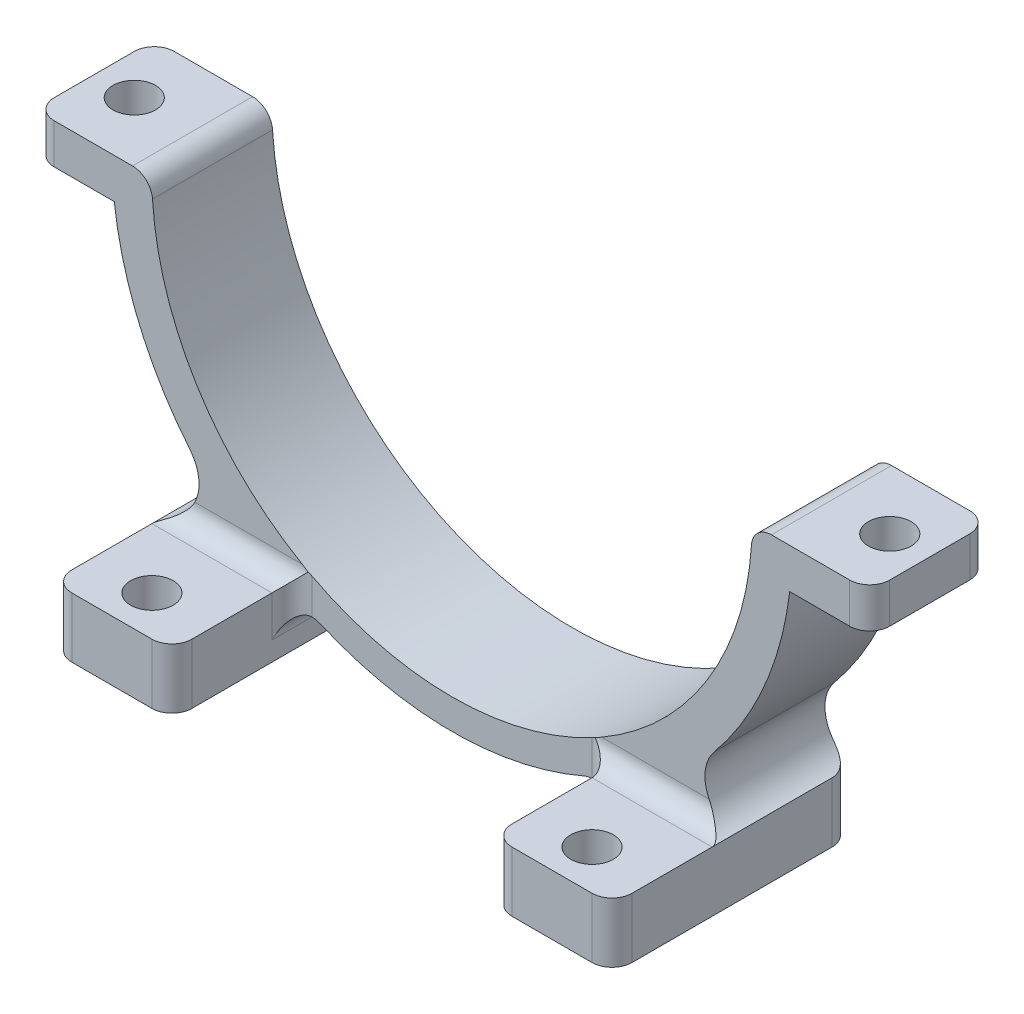
from build123d import *

# Parameters (mm, degrees)
BOSS_EXTRUDE2_DEPTH = 9.525
CUT_EXTRUDE2_REACH  = 84.186
SKETCH5_R           = 3.3782
BOSS_EXTRUDE3_DEPTH = 19.05
CUT_EXTRUDE3_REACH  = 86.782
SKETCH7_R           = 3.3782
CUT_EXTRUDE5_REACH  = 89.589
FILLET3_R           = 6.35
FILLET4_R           = 3.175


with BuildPart() as part:
    # Sketch1 → Boss-Extrude2 (new, symmetric)
    with BuildSketch(Plane.XY):
        with BuildLine():
            Line((-47.62499999999999, 0), (-66.30016907622587, -2.27e-15))
            Line((-66.30016907622587, -2.27e-15), (-66.30016907622587, -6.350000000000002))
            Line((-66.30016907622587, -6.350000000000002), (-53.60016907622586, -6.350000000000002))
            ThreePointArc((-53.60016907622586, -6.350000000000002), (-46.217987777388224, -27.87827524810658), (-30.618591166152626, -44.449999999999996))
            Line((-30.618591166152626, -44.449999999999996), (-44.449999999999996, -44.449999999999996))
            Line((-44.449999999999996, -44.449999999999996), (-44.449999999999996, -53.975))
            Line((-44.449999999999996, -53.975), (44.449999999999996, -53.975))
            Line((44.449999999999996, -53.975), (44.449999999999996, -44.449999999999996))
            Line((44.449999999999996, -44.449999999999996), (30.618591166152626, -44.449999999999996))
            ThreePointArc((30.618591166152626, -44.449999999999996), (46.21798777738823, -27.878275248106572), (53.60016907622586, -6.350000000000002))
            Line((53.60016907622586, -6.350000000000002), (66.30016907622587, -6.350000000000002))
            Line((66.30016907622587, -6.350000000000002), (66.30016907622587, -2.27e-15))
            Line((66.30016907622587, -2.27e-15), (47.62499999999999, 0))
            ThreePointArc((47.62499999999999, 0), (-8.75e-15, -47.62499999999999), (-47.62499999999999, 0))
        make_face()
    extrude(amount=BOSS_EXTRUDE2_DEPTH, both=True)

    # Sketch5 → Cut-Extrude2 (cut, up to next)
    with BuildSketch(Plane.XZ.offset(6.350000000000002), mode=Mode.PRIVATE) as cut_extrude2_sk1:
        with Locations(Location((-59.95016907622586, 0, 0), (0, 0, 270))):
            Circle(SKETCH5_R)
    cut_extrude2_tool1 = extrude(cut_extrude2_sk1.sketch, amount=-CUT_EXTRUDE2_REACH, mode=Mode.PRIVATE) & part.part
    # Sketch5 → Cut-Extrude2 (cut, up to next)
    with BuildSketch(Plane.XZ.offset(6.350000000000002), mode=Mode.PRIVATE) as cut_extrude2_sk2:
        with Locations(Location((59.95016907622586, 0, 0), (0, 0, 270))):
            Circle(SKETCH5_R)
    cut_extrude2_tool2 = extrude(cut_extrude2_sk2.sketch, amount=-CUT_EXTRUDE2_REACH, mode=Mode.PRIVATE) & part.part
    add(cut_extrude2_tool1.solids().sort_by_distance((-59.950169, -6.35, 0))[0], mode=Mode.SUBTRACT)
    add(cut_extrude2_tool2.solids().sort_by_distance((59.950169, -6.35, 0))[0], mode=Mode.SUBTRACT)

    # Sketch6 → Boss-Extrude3 (add)
    with BuildSketch(Plane.XY.offset(9.525)):
        Polygon((-44.449999999999996, -44.449999999999996), (-25.39999999999999, -44.449999999999996), (-25.399999999999995, -53.975), (-44.449999999999996, -53.975), align=None)
        Polygon((44.449999999999996, -53.975), (25.399999999999995, -53.975), (25.39999999999999, -44.449999999999996), (44.449999999999996, -44.449999999999996), align=None)
    extrude(amount=BOSS_EXTRUDE3_DEPTH)

    # Sketch7 → Cut-Extrude3 (cut, up to next)
    with BuildSketch(Plane(origin=(0, -44.449999999999996, 0), x_dir=(1, 0, 0), z_dir=(0, 1, 0)), mode=Mode.PRIVATE) as cut_extrude3_sk1:
        with Locations(Location((-34.925, -22.225, 0), (0, 0, 270))):
            Circle(SKETCH7_R)
    cut_extrude3_tool1 = extrude(cut_extrude3_sk1.sketch, amount=-CUT_EXTRUDE3_REACH, mode=Mode.PRIVATE) & part.part
    # Sketch7 → Cut-Extrude3 (cut, up to next)
    with BuildSketch(Plane(origin=(0, -44.449999999999996, 0), x_dir=(1, 0, 0), z_dir=(0, 1, 0)), mode=Mode.PRIVATE) as cut_extrude3_sk2:
        with Locations(Location((34.925, -22.225, 0), (0, 0, 270))):
            Circle(SKETCH7_R)
    cut_extrude3_tool2 = extrude(cut_extrude3_sk2.sketch, amount=-CUT_EXTRUDE3_REACH, mode=Mode.PRIVATE) & part.part
    add(cut_extrude3_tool1.solids().sort_by_distance((-34.925, -44.45, 22.225))[0], mode=Mode.SUBTRACT)
    add(cut_extrude3_tool2.solids().sort_by_distance((34.925, -44.45, 22.225))[0], mode=Mode.SUBTRACT)

    # Sketch10 → Cut-Extrude5 (cut, up to next)
    with BuildSketch(Plane.XY.offset(9.525), mode=Mode.PRIVATE) as cut_extrude5_sk1:
        with BuildLine():
            Line((-25.4, -45.81801126467626), (-25.399999999999995, -53.975))
            Line((-25.399999999999995, -53.975), (25.399999999999995, -53.975))
            Line((25.399999999999995, -53.975), (25.39999999999999, -45.818011264676265))
            ThreePointArc((25.39999999999999, -45.818011264676265), (3.21e-15, -52.3875), (-25.4, -45.81801126467626))
        make_face()
    cut_extrude5_tool1 = extrude(cut_extrude5_sk1.sketch, amount=-CUT_EXTRUDE5_REACH, mode=Mode.PRIVATE) & part.part
    add(cut_extrude5_tool1.solids().sort_by_distance((-24.885493, -49.896506, 9.525))[0], mode=Mode.SUBTRACT)

    # Fillet3
    # the kernel refuses this fillet: 6.35 mm, written as the material it adds along each edge
    with BuildSketch(Plane(origin=(30.618591166152626, -44.449999999999996, -9.525), x_dir=(1, -5.1e-16, 0), z_dir=(0, 0, 1))) as fillet3_piece_1:
        with BuildLine():
            CenterArc((15.87487517374333, 6.012216339895979), FILLET3_R, 140.4182638704102, 110.80957357767647)
            Line((10.980826085333229, 10.058298830433243), (10.88294510356503, 10.13922048024399))
            ThreePointArc((10.88294510356503, 10.13922048024399), (5.753170572776132, 4.742292284663466), (-0.07204374392036078, 0.10458823529411627))
            Line((-0.07204374392036078, 0.10458823529411627), (7e-17, -0.12700000000000244))
            ThreePointArc((7e-17, -0.12700000000000244), (6.915704416923688, -0.1269999999999989), (13.790539507049452, -0.12024432679791633))
            Line((13.790539507049452, -0.12024432679791633), (13.83140883384737, 0))
        make_face()
    extrude(amount=19.05)
    with BuildSketch(Plane(origin=(-30.618591166152626, -44.45, -9.525), x_dir=(-0.7374035751622449, 0.6754524167829585, 0), z_dir=(0, 0, 1))) as fillet3_piece_2:
        with BuildLine():
            CenterArc((15.767155765377446, 6.2892929785445775), FILLET3_R, 151.26145537711756, 110.80957357767625)
            Line((10.199330323609711, 9.342458524335363), (10.08797381477436, 9.403521835251178))
            ThreePointArc((10.08797381477436, 9.403521835251178), (5.013882704873423, 4.764879516213288), (-0.08578245693143738, 0.0936502540456069))
            Line((-0.08578245693143738, 0.0936502540456069), (0.01751906196152835, -0.1257858595708917))
            ThreePointArc((0.01751906196152835, -0.1257858595708917), (7.445601333650467, 0.3890096823710894), (14.873683605339394, -0.12578585957089045))
            Line((14.873683605339394, -0.12578585957089045), (14.89120266730092, 1.6e-16))
        make_face()
    extrude(amount=19.05)

    # Fillet4
    # the kernel refuses this fillet: 3.175 mm, written as the material it adds along each edge
    with BuildSketch(Plane(origin=(-44.45000000000031, -44.44999999999735, 9.525), x_dir=(1.3875e-13, 1, -5.6e-16), z_dir=(1, -1.3875e-13, 0))) as fillet4_piece_1_section:
        with BuildLine():
            CenterArc((FILLET4_R, FILLET4_R), FILLET4_R, 180.00000000000003, 90)
            Line((-8.88e-15, FILLET4_R), (0, 0))
            Line((0, 0), (FILLET4_R, 0))
        make_face()
    fillet4_piece_1 = extrude(amount=19.050000000000317, mode=Mode.PRIVATE)
    fillet4_piece_1 = fillet4_piece_1 - Plane(origin=(-46.493466339895136, -38.43778366010152, 10.266773155518875), x_dir=(-0.7374035751621124, 0.6754524167831031, 0), z_dir=(0, 0, -1)) * Cylinder(6.35, 51, mode=Mode.PRIVATE)
    add(fillet4_piece_1)
    with BuildSketch(Plane(origin=(25.39999999999999, -44.449999999999996, 9.525), x_dir=(-7.5e-16, 1, -5.6e-16), z_dir=(1, 7.5e-16, 0))) as fillet4_piece_2_section:
        with BuildLine():
            CenterArc((FILLET4_R, FILLET4_R), FILLET4_R, 180.00000000000003, 90)
            Line((-8.88e-15, FILLET4_R), (0, 0))
            Line((0, 0), (FILLET4_R, 0))
        make_face()
    fillet4_piece_2 = extrude(amount=19.049999999999997, mode=Mode.PRIVATE)
    fillet4_piece_2 = fillet4_piece_2 - Plane(origin=(46.493466339896, -38.437783660104, 10.26677297379504), x_dir=(1, 0, 0), z_dir=(0, 0, -1)) * Cylinder(6.35, 51, mode=Mode.PRIVATE)
    add(fillet4_piece_2)
    with BuildSketch(Plane(origin=(25.399999999999984, -53.75551126467627, 9.525), x_dir=(-1, -3.7e-16, -5.6e-16), z_dir=(-3.7e-16, 1, 0))) as fillet4_piece_3_section:
        with BuildLine():
            CenterArc((FILLET4_R, FILLET4_R), FILLET4_R, 180.00000000000003, 90)
            Line((-5.33e-15, FILLET4_R), (0, 0))
            Line((0, 0), (FILLET4_R, 0))
        make_face()
    fillet4_piece_3 = extrude(amount=9.305511264676277, mode=Mode.PRIVATE)
    fillet4_piece_3 = fillet4_piece_3 & Plane(origin=(4.44e-15, 3.553e-14, 10.160375888913034), x_dir=(0.4848484848484843, -0.8745981630098072, 0), z_dir=(0, 0, 1)) * Cylinder(52.387500000000024, 32, mode=Mode.PRIVATE)
    add(fillet4_piece_3)
    with BuildSketch(Plane(origin=(-25.39999999999999, -44.449999999999996, 9.525), x_dir=(1, -3.7e-16, -5.6e-16), z_dir=(-3.7e-16, -1, 0))) as fillet4_piece_4_section:
        with BuildLine():
            CenterArc((FILLET4_R, FILLET4_R), FILLET4_R, 180.00000000000003, 90)
            Line((-5.33e-15, FILLET4_R), (0, 0))
            Line((0, 0), (FILLET4_R, 0))
        make_face()
    fillet4_piece_4 = extrude(amount=9.305511264676262, mode=Mode.PRIVATE)
    fillet4_piece_4 = fillet4_piece_4 & Plane(origin=(4.44e-15, 3.553e-14, 10.160372154025156), x_dir=(0.4848484848484843, -0.8745981630098072, 0), z_dir=(0, 0, 1)) * Cylinder(52.387500000000024, 32, mode=Mode.PRIVATE)
    add(fillet4_piece_4)
    with BuildSketch(Plane(origin=(-25.4, -45.81801126467626, 9.525), x_dir=(7e-16, -1, 0), z_dir=(0, 0, -1))) as fillet4_piece_5:
        with BuildLine():
            CenterArc((5.1058611455205085, -3.1750000000000007), FILLET4_R, 90.00000000000004, 113.57817847820172)
            ThreePointArc((2.1959255792235512, -4.444999999999995), (1.1505753407627795, -2.196508268422785), (0, 0))
            Line((0, 0), (5.105861145520507, 0))
        make_face()
    extrude(amount=19.05)
    with BuildSketch(Plane(origin=(25.39999999999999, -45.81801126467626, 9.525), x_dir=(-0.8965609468945661, -0.44292038619092594, 0), z_dir=(0, 0, -1))) as fillet4_piece_6:
        with BuildLine():
            CenterArc((5.108070996801428, -3.1714434771838524), FILLET4_R, 92.71218377423436, 113.57817847820183)
            Line((2.26148999041118, -4.577715703340043), (0, 0))
            ThreePointArc((0, 0), (2.4789168072712826, -0.05868262646643985), (4.957833614542567, -4e-17))
        make_face()
    extrude(amount=19.05)
    with BuildSketch(Plane(origin=(-44.45000000000031, -44.44999999999735, 9.525), x_dir=(1.3875e-13, 1, -5.6e-16), z_dir=(1, -1.3875e-13, 0))) as fillet4_piece_7a_section:
        with BuildLine():
            CenterArc((FILLET4_R, FILLET4_R), FILLET4_R, 180.00000000000003, 90)
            Line((-8.88e-15, FILLET4_R), (0, 0))
            Line((0, 0), (FILLET4_R, 0))
        make_face()
    fillet4_piece_7a = extrude(amount=26.987500000000313, mode=Mode.PRIVATE)
    fillet4_piece_7a = fillet4_piece_7a - Plane(origin=(-1.78e-15, -1.78e-15, 10.332620493512062), x_dir=(1, 4e-17, 0), z_dir=(0, 0, 1)) * Cylinder(47.62499999999999, 67, mode=Mode.PRIVATE)
    fillet4_piece_7a = split(fillet4_piece_7a, bisect_by=Plane(origin=(-25.4, -43.88290826667805, 10.332620493512062), z_dir=(1, 4.4e-16, 0)), keep=Keep.TOP, mode=Mode.PRIVATE)
    with BuildSketch(Plane(origin=(-25.400000000000002, -36.512499999999996, 9.525), x_dir=(1, -3.7e-16, -5.6e-16), z_dir=(-3.7e-16, -1, 0))) as fillet4_piece_7b_section:
        with BuildLine():
            CenterArc((FILLET4_R, FILLET4_R), FILLET4_R, 180.00000000000003, 90)
            Line((-1.78e-15, FILLET4_R), (0, 0))
            Line((0, 0), (FILLET4_R, 0))
        make_face()
    fillet4_piece_7b = extrude(amount=17.243011264676262, mode=Mode.PRIVATE)
    fillet4_piece_7b = fillet4_piece_7b - Plane(origin=(-1.78e-15, -1.78e-15, 10.288288962846478), x_dir=(1, 4e-17, 0), z_dir=(0, 0, 1)) * Cylinder(47.62499999999999, 48, mode=Mode.PRIVATE)
    fillet4_piece_7b = split(fillet4_piece_7b, bisect_by=Plane(origin=(-24.755790734076196, -44.449999999999996, 10.288288962846478), z_dir=(0, 1, 0)), keep=Keep.TOP, mode=Mode.PRIVATE)
    fillet4_piece_7 = fillet4_piece_7a & fillet4_piece_7b
    add(fillet4_piece_7)
    with BuildSketch(Plane(origin=(17.46249999999999, -44.44999999999999, 9.525), x_dir=(-7.5e-16, 1, -5.6e-16), z_dir=(1, 7.5e-16, 0))) as fillet4_piece_8a_section:
        with BuildLine():
            CenterArc((FILLET4_R, FILLET4_R), FILLET4_R, 180.00000000000003, 90)
            Line((-1.78e-15, FILLET4_R), (0, 0))
            Line((0, 0), (FILLET4_R, 0))
        make_face()
    fillet4_piece_8a = extrude(amount=26.987499999999994, mode=Mode.PRIVATE)
    fillet4_piece_8a = fillet4_piece_8a - Plane(origin=(-1.78e-15, -1.78e-15, 10.33262094142748), x_dir=(1, 4e-17, 0), z_dir=(0, 0, 1)) * Cylinder(47.62499999999999, 67, mode=Mode.PRIVATE)
    fillet4_piece_8a = split(fillet4_piece_8a, bisect_by=Plane(origin=(25.39999999999999, -43.882907820027945, 10.33262094142748), z_dir=(-1, -4.4e-16, 0)), keep=Keep.TOP, mode=Mode.PRIVATE)
    with BuildSketch(Plane(origin=(25.399999999999984, -53.75551126467627, 9.525), x_dir=(-1, -3.7e-16, -5.6e-16), z_dir=(-3.7e-16, 1, 0))) as fillet4_piece_8b_section:
        with BuildLine():
            CenterArc((FILLET4_R, FILLET4_R), FILLET4_R, 180.00000000000003, 90)
            Line((-5.33e-15, FILLET4_R), (0, 0))
            Line((0, 0), (FILLET4_R, 0))
        make_face()
    fillet4_piece_8b = extrude(amount=17.243011264676284, mode=Mode.PRIVATE)
    fillet4_piece_8b = fillet4_piece_8b - Plane(origin=(-1.78e-15, -1.78e-15, 10.28828876878144), x_dir=(1, 4e-17, 0), z_dir=(0, 0, 1)) * Cylinder(47.62499999999999, 48, mode=Mode.PRIVATE)
    fillet4_piece_8b = split(fillet4_piece_8b, bisect_by=Plane(origin=(24.755792568024695, -44.449999999999996, 10.28828876878144), z_dir=(0, 1, 0)), keep=Keep.TOP, mode=Mode.PRIVATE)
    fillet4_piece_8 = fillet4_piece_8a & fillet4_piece_8b
    add(fillet4_piece_8)
    with BuildSketch(Plane(origin=(25.399999999999984, -53.75551126467627, 9.525), x_dir=(-1, -3.7e-16, -5.6e-16), z_dir=(-3.7e-16, 1, 0))) as fillet4_piece_9a_section:
        with BuildLine():
            CenterArc((FILLET4_R, FILLET4_R), FILLET4_R, 180.00000000000003, 90)
            Line((-5.33e-15, FILLET4_R), (0, 0))
            Line((0, 0), (FILLET4_R, 0))
        make_face()
    fillet4_piece_9a = extrude(amount=9.305511264676277, mode=Mode.PRIVATE)
    fillet4_piece_9a = fillet4_piece_9a - Plane(origin=(4.44e-15, 3.553e-14, 10.263166034588224), x_dir=(0.4848484848484843, -0.8745981630098072, 0), z_dir=(0, 0, 1)) * Cylinder(52.387500000000024, 32, mode=Mode.PRIVATE)
    with BuildSketch(Plane(origin=(25.39999999999999, -45.81801126467626, 22.289652863801265), x_dir=(-0.8965609468945661, -0.44292038619092594, 0), z_dir=(0, 0, -1))) as fillet4_piece_9b_section:
        with BuildLine():
            CenterArc((5.108070996801428, -3.1714434771838524), FILLET4_R, 92.71218377423436, 113.57817847820183)
            Line((2.26148999041118, -4.577715703340043), (0, 0))
            ThreePointArc((0, 0), (2.4789168072712826, -0.05868262646643985), (4.957833614542567, -4e-17))
        make_face()
    fillet4_piece_9b = extrude(amount=31.814652863801264, mode=Mode.PRIVATE)
    fillet4_piece_9b = split(fillet4_piece_9b, bisect_by=Plane(origin=(24.331684208518332, -47.62488744049409, 9.525), z_dir=(0, 0, 1)), keep=Keep.TOP, mode=Mode.PRIVATE)
    fillet4_piece_9 = fillet4_piece_9a & fillet4_piece_9b
    add(fillet4_piece_9)
    with BuildSketch(Plane(origin=(-25.39999999999999, -44.449999999999996, 9.525), x_dir=(1, -3.7e-16, -5.6e-16), z_dir=(-3.7e-16, -1, 0))) as fillet4_piece_10a_section:
        with BuildLine():
            CenterArc((FILLET4_R, FILLET4_R), FILLET4_R, 180.00000000000003, 90)
            Line((-5.33e-15, FILLET4_R), (0, 0))
            Line((0, 0), (FILLET4_R, 0))
        make_face()
    fillet4_piece_10a = extrude(amount=9.305511264676262, mode=Mode.PRIVATE)
    fillet4_piece_10a = fillet4_piece_10a - Plane(origin=(4.44e-15, 3.553e-14, 10.263163738620651), x_dir=(0.4848484848484843, -0.8745981630098072, 0), z_dir=(0, 0, 1)) * Cylinder(52.387500000000024, 32, mode=Mode.PRIVATE)
    with BuildSketch(Plane(origin=(-25.4, -45.81801126467625, 22.289652863801265), x_dir=(7e-16, -1, 0), z_dir=(0, 0, -1))) as fillet4_piece_10b_section:
        with BuildLine():
            CenterArc((5.105861145520516, -3.1750000000000007), FILLET4_R, 90.00000000000004, 113.57817847820172)
            ThreePointArc((2.1959255792235584, -4.444999999999995), (1.1505753407627866, -2.196508268422785), (0, 0))
            Line((0, 0), (5.105861145520514, 0))
        make_face()
    fillet4_piece_10b = extrude(amount=31.814652863801264, mode=Mode.PRIVATE)
    fillet4_piece_10b = split(fillet4_piece_10b, bisect_by=Plane(origin=(-24.331684208518332, -47.624887440494085, 9.525), z_dir=(0, 0, 1)), keep=Keep.TOP, mode=Mode.PRIVATE)
    fillet4_piece_10 = fillet4_piece_10a & fillet4_piece_10b
    add(fillet4_piece_10)
    # the kernel refuses this fillet: 3.175 mm, written as the material it takes off along each edge
    with BuildSketch(Plane(origin=(-66.30016907622587, 7.937499999999994, 9.525), x_dir=(0, 0, -1), z_dir=(0, -1, 0))) as fillet4_2_piece_1:
        with BuildLine():
            CenterArc((FILLET4_R, FILLET4_R), FILLET4_R, 180, 90)
            Line((-1.78e-15, FILLET4_R), (0, 0))
            Line((0, 0), (FILLET4_R, 0))
        make_face()
    extrude(amount=22.22499999999999, mode=Mode.SUBTRACT)
    with BuildSketch(Plane(origin=(66.30016907622587, -14.287500000000016, -9.525), x_dir=(-1, 0, 0), z_dir=(0, 1, 0)), Plane(origin=(-66.30016907622587, 7.937499999999986, -9.525), x_dir=(1, 0, 0), z_dir=(0, -1, 0))) as fillet4_2_piece_2:
        with BuildLine():
            CenterArc((FILLET4_R, FILLET4_R), FILLET4_R, 180, 90)
            Line((0, FILLET4_R), (0, 0))
            Line((0, 0), (FILLET4_R, 0))
        make_face()
    extrude(amount=22.22499999999999, mode=Mode.SUBTRACT)
    with BuildSketch(Plane(origin=(44.449999999999996, -61.912499999999994, -9.525), x_dir=(-1, 0, 0), z_dir=(0, 1, 0))) as fillet4_2_piece_3:
        with BuildLine():
            CenterArc((FILLET4_R, FILLET4_R), FILLET4_R, 180, 90)
            Line((0, FILLET4_R), (0, 0))
            Line((0, 0), (FILLET4_R, 0))
        make_face()
    extrude(amount=25.4, mode=Mode.SUBTRACT)
    with BuildSketch(Plane(origin=(-44.449999999999996, -36.512499999999996, -9.525), x_dir=(1, 0, 0), z_dir=(0, -1, 0))) as fillet4_2_piece_4:
        with BuildLine():
            CenterArc((FILLET4_R, FILLET4_R), FILLET4_R, 180, 90)
            Line((-7.11e-15, FILLET4_R), (0, 0))
            Line((0, 0), (FILLET4_R, 0))
        make_face()
    extrude(amount=25.4, mode=Mode.SUBTRACT)
    with BuildSketch(Plane(origin=(47.62499999999999, 0, 17.21421041746987), x_dir=(1, -1.4e-16, 0), z_dir=(0, 0, -1))) as fillet4_2_piece_5:
        with BuildLine():
            CenterArc((3.075684166987948, 3.175), FILLET4_R, 183.58332169847216, 86.41667830152784)
            ThreePointArc((-0.0931085934483913, 2.976562499999989), (-0.02328283960383693, 1.4890091946139992), (0, 0))
            Line((0, 0), (3.0756841669879478, 0))
        make_face()
    extrude(amount=34.42842083493974, mode=Mode.SUBTRACT)
    with BuildSketch(Plane(origin=(-47.62499999999999, -9.39e-15, 17.21421041747397), x_dir=(0.03126528492627727, -0.9995111214781347, 0), z_dir=(0, 0, -1))) as fillet4_2_piece_6:
        with BuildLine():
            CenterArc((3.0772856688687185, 3.173447810693077), FILLET4_R, 181.79166084908871, 86.41667830167557)
            Line((-0.09616214182461408, 3.074180531060293), (0, 0))
            ThreePointArc((0, 0), (1.4890091946139077, 0.02328283960383078), (2.978018389227795, 0))
        make_face()
    extrude(amount=34.42842083494794, mode=Mode.SUBTRACT)
    with BuildSketch(Plane(origin=(-44.449999999999996, -61.9125, 28.575000000000003), x_dir=(1, 0, 0), z_dir=(0, 1, 0)), Plane(origin=(44.449999999999996, -36.512499999999996, 28.575000000000003), x_dir=(-1, 0, 0), z_dir=(0, -1, 0))) as fillet4_2_piece_7:
        with BuildLine():
            CenterArc((FILLET4_R, FILLET4_R), FILLET4_R, 180, 90)
            Line((0, FILLET4_R), (0, 0))
            Line((0, 0), (FILLET4_R, 0))
        make_face()
    extrude(amount=25.400000000000013, mode=Mode.SUBTRACT)
    with BuildSketch(Plane(origin=(-25.400000000000002, -36.512499999999996, 28.575000000000003), x_dir=(-1, 3.7e-16, 0), z_dir=(-3.7e-16, -1, 0)), Plane(origin=(25.4, -61.9125, 28.575000000000003), x_dir=(1, 3.7e-16, 0), z_dir=(-3.7e-16, 1, 0))) as fillet4_2_piece_8:
        with BuildLine():
            CenterArc((FILLET4_R, FILLET4_R), FILLET4_R, 180, 90)
            Line((0, FILLET4_R), (0, 0))
            Line((0, 0), (FILLET4_R, 0))
        make_face()
    extrude(amount=25.400000000000013, mode=Mode.SUBTRACT)
    with BuildSketch(Plane(origin=(66.30016907622587, -14.287500000000016, 9.525), x_dir=(-1, 0, 0), z_dir=(0, 1, 0))) as fillet4_2_piece_9:
        with BuildLine():
            CenterArc((FILLET4_R, -FILLET4_R), FILLET4_R, 90, 90)
            Line((0, -FILLET4_R), (0, 0))
            Line((0, 0), (FILLET4_R, 0))
        make_face()
    extrude(amount=22.22499999999999, mode=Mode.SUBTRACT)


solid = part.part
